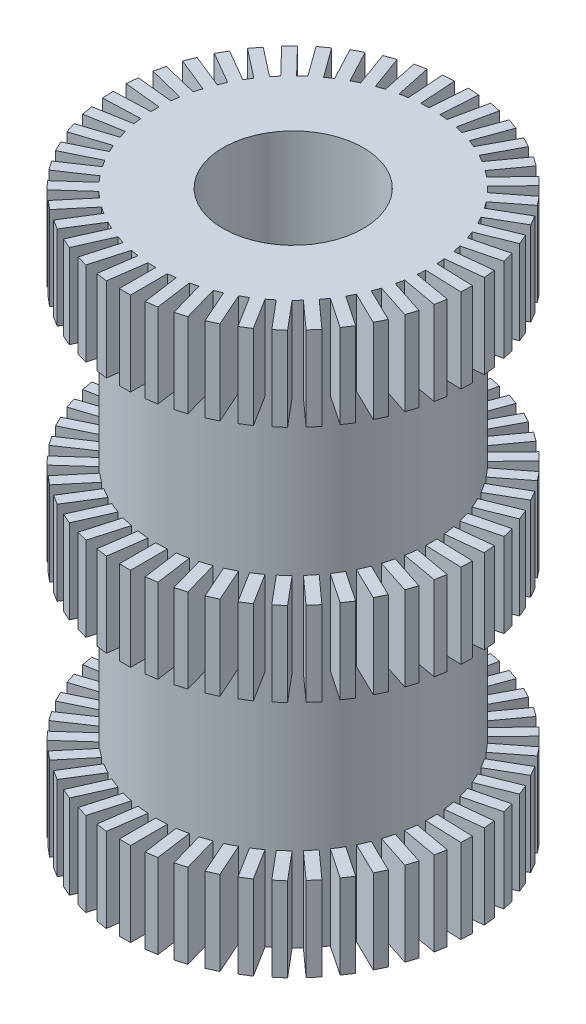
from build123d import *

# Parameters (mm, degrees)
SKETCH1_R                       = 2.45
BOSS_EXTRUDE1_DEPTH             = 10
M3X0_5_TAPPED_HOLE1_D           = 2.5
SKETCH4_W                       = 0.2
SKETCH4_H                       = 1.5
BOSS_EXTRUDE2_DEPTH             = 0.1
BOSS_EXTRUDE2_DIRECTION_2_REACH = 13.649
CIRPATTERN1_COUNT               = 45


with BuildPart() as part:
    # Sketch1 → Boss-Extrude1 (new body)
    with BuildSketch(Plane(origin=(0, 0, 0), x_dir=(1, 0, 0), z_dir=(0, 1, 0))):
        Circle(SKETCH1_R)
    extrude(amount=BOSS_EXTRUDE1_DEPTH)

    # M3x0.5 Tapped Hole1 (through all)
    with Locations(Plane(origin=(0, 10, 0), x_dir=(1, 0, 0), z_dir=(0, 1, 0))):
        with Locations((0, 0)):
            Hole(M3X0_5_TAPPED_HOLE1_D / 2)

    # Sketch4 → Boss-Extrude2 (add)
    with BuildSketch(Plane.XY.offset(3)):
        with Locations((0.1, 9.25)):
            Rectangle(SKETCH4_W, SKETCH4_H)
        with Locations((0.1, 0.75)):
            Rectangle(SKETCH4_W, SKETCH4_H)
        with Locations((0.1, 5)):
            Rectangle(SKETCH4_W, SKETCH4_H)
    boss_extrude2 = extrude(amount=BOSS_EXTRUDE2_DEPTH)

    # Sketch4 → Boss-Extrude2 direction 2 (add, up to next)
    with BuildSketch(Plane.XY.offset(3), mode=Mode.PRIVATE) as boss_extrude2_direction_2_sk1:
        with Locations((0.1, 9.25)):
            Rectangle(SKETCH4_W, SKETCH4_H)
    boss_extrude2_direction_2_tool1 = extrude(boss_extrude2_direction_2_sk1.sketch, amount=-BOSS_EXTRUDE2_DIRECTION_2_REACH, mode=Mode.PRIVATE) - part.part
    # Sketch4 → Boss-Extrude2 direction 2 (add, up to next)
    with BuildSketch(Plane.XY.offset(3), mode=Mode.PRIVATE) as boss_extrude2_direction_2_sk2:
        with Locations((0.1, 0.75)):
            Rectangle(SKETCH4_W, SKETCH4_H)
    boss_extrude2_direction_2_tool2 = extrude(boss_extrude2_direction_2_sk2.sketch, amount=-BOSS_EXTRUDE2_DIRECTION_2_REACH, mode=Mode.PRIVATE) - part.part
    # Sketch4 → Boss-Extrude2 direction 2 (add, up to next)
    with BuildSketch(Plane.XY.offset(3), mode=Mode.PRIVATE) as boss_extrude2_direction_2_sk3:
        with Locations((0.1, 5)):
            Rectangle(SKETCH4_W, SKETCH4_H)
    boss_extrude2_direction_2_tool3 = extrude(boss_extrude2_direction_2_sk3.sketch, amount=-BOSS_EXTRUDE2_DIRECTION_2_REACH, mode=Mode.PRIVATE) - part.part
    boss_extrude2_direction_2_1 = boss_extrude2_direction_2_tool1.solids().sort_by_distance((0.1, 9.25, 3))[0]
    add(boss_extrude2_direction_2_1)
    boss_extrude2_direction_2_2 = boss_extrude2_direction_2_tool2.solids().sort_by_distance((0.1, 0.75, 3))[0]
    add(boss_extrude2_direction_2_2)
    boss_extrude2_direction_2_3 = boss_extrude2_direction_2_tool3.solids().sort_by_distance((0.1, 5, 3))[0]
    add(boss_extrude2_direction_2_3)
    boss_extrude2_direction_2 = boss_extrude2_direction_2_1 + boss_extrude2_direction_2_2 + boss_extrude2_direction_2_3  # Boss-Extrude2 direction 2 as one shape, for the pattern or mirror that repeats it

    # CirPattern1: Boss-Extrude2, Boss-Extrude2 direction 2 ×45 about axis
    cirpattern1_axis = Axis((0, 10, 0), (0, 1, 0))
    add([boss_extrude2.rotate(cirpattern1_axis, i * 360 / CIRPATTERN1_COUNT) for i in range(1, CIRPATTERN1_COUNT)])
    add([boss_extrude2_direction_2.rotate(cirpattern1_axis, i * 360 / CIRPATTERN1_COUNT) for i in range(1, CIRPATTERN1_COUNT)])


solid = part.part
